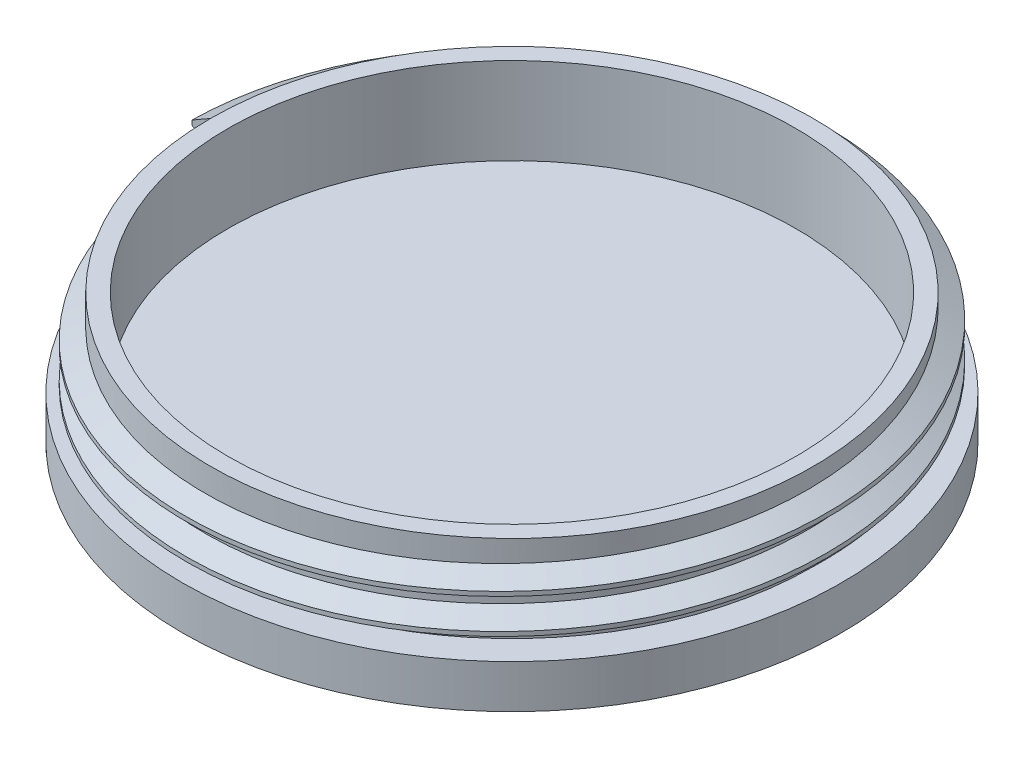
from build123d import *
from build123d.topology import SkipClean

# Parameters (mm, degrees)
SKETCH1_R           = 38
BOSS_EXTRUDE1_DEPTH = 5
SKETCH1_4_R         = 34.75
BOSS_EXTRUDE2_DEPTH = 10
THREAD1_PITCH       = 4
SKETCH6_R           = 32.750011187
CUT_EXTRUDE1_DEPTH  = 10


with BuildPart() as part:
    # Sketch1 → Boss-Extrude1 (new body)
    with BuildSketch(Plane(origin=(0, 0, 0), x_dir=(1, 0, 0), z_dir=(0, 1, 0))):
        with Locations(Location((0, 0, 0), (0, 0, 270))):
            Circle(SKETCH1_R)
    extrude(amount=-BOSS_EXTRUDE1_DEPTH)

    # Sketch1<4> → Boss-Extrude2 (add)
    with BuildSketch(Plane(origin=(0, 0, 0), x_dir=(1, 0, 0), z_dir=(0, 1, 0))):
        with Locations(Location((0, 0, 0), (0, 0, 270))):
            Circle(SKETCH1_4_R)
    extrude(amount=BOSS_EXTRUDE2_DEPTH)

    # Thread1: the profile of Thread Profile1 profile screwed along a right-hand helix of 2.5 turns, 12 arcs to a turn; built about Z, then put on its axis
    thread1_z = Axis((0, 0, 0), (0, 0, 1))
    thread1_corners = [(34.7497, 0, -0.000173205), (36.9150635, 0, 1.249999995), (36.9150635, 0, 1.749999995), (34.7497, 0, 3.000173194)]
    with BuildLine(mode=Mode.PRIVATE) as thread1_profile:
        Line(thread1_corners[0], thread1_corners[1])
        Line(thread1_corners[1], thread1_corners[2])
        Line(thread1_corners[2], thread1_corners[3])
        Line(thread1_corners[3], thread1_corners[0])
    thread1_cap = Face(thread1_profile.wire())
    thread1_turn_angles = [0, 15, 30, 45, 60, 75, 90, 105, 120, 135, 150, 165, 180, 195, 210, 225, 240, 255, 270, 285, 300, 315, 330, 345, 360]
    thread1_turn_weights = [1, 0.9659258262890683, 1, 0.9659258262890683, 1, 0.9659258262890683, 1, 0.9659258262890683, 1, 0.9659258262890683, 1, 0.9659258262890683, 1, 0.9659258262890683, 1, 0.9659258262890683, 1, 0.9659258262890683, 1, 0.9659258262890683, 1, 0.9659258262890683, 1, 0.9659258262890683, 1]
    thread1_turn_rails = [Edge.make_bspline([Vector(p[0], p[1], 0).rotate(thread1_z, thread1_turn_angles[k]) / thread1_turn_weights[k] + Vector(0, 0, p[2] + THREAD1_PITCH * thread1_turn_angles[k] / 360) for k in range(25)], [0, 0, 0, 1, 1, 2, 2, 3, 3, 4, 4, 5, 5, 6, 6, 7, 7, 8, 8, 9, 9, 10, 10, 11, 11, 12, 12, 12], 2, thread1_turn_weights) for p in thread1_corners]
    thread1_turn_sides = [Face.make_surface_from_curves(thread1_turn_rails[p[0]], thread1_turn_rails[p[1]]) for p in [(0, 1), (1, 2), (2, 3), (3, 0)]]
    thread1_last_angles = [720, 735, 750, 765, 780, 795, 810, 825, 840, 855, 870, 885, 900]
    thread1_last_weights = [1, 0.9659258262890683, 1, 0.9659258262890683, 1, 0.9659258262890683, 1, 0.9659258262890683, 1, 0.9659258262890683, 1, 0.9659258262890683, 1]
    thread1_last_rails = [Edge.make_bspline([Vector(p[0], p[1], 0).rotate(thread1_z, thread1_last_angles[k]) / thread1_last_weights[k] + Vector(0, 0, p[2] + THREAD1_PITCH * thread1_last_angles[k] / 360) for k in range(13)], [0, 0, 0, 1, 1, 2, 2, 3, 3, 4, 4, 5, 5, 6, 6, 6], 2, thread1_last_weights) for p in thread1_corners]
    thread1_last_sides = [Face.make_surface_from_curves(thread1_last_rails[p[0]], thread1_last_rails[p[1]]) for p in [(0, 1), (1, 2), (2, 3), (3, 0)]]
    thread1 = Plane(origin=(0, 10, 0), x_dir=(-1, 0, 0), z_dir=(0, -1, 0)) * Solid(Shell([*[p.moved(Location((0, 0, THREAD1_PITCH * i))) for i in range(2) for p in thread1_turn_sides], *thread1_last_sides, thread1_cap, thread1_cap.rotate(thread1_z, 900).moved(Location((0, 0, THREAD1_PITCH * 900 / 360)))]))
    add(thread1)

    # Sketch6 → Cut-Extrude1 (cut)
    with SkipClean():  # the faces are left unmerged after this step: merging them gives an invalid solid
        with BuildSketch(Plane(origin=(0, 10, 0), x_dir=(1, 0, 0), z_dir=(0, 1, 0))):
            with Locations(Location((0, 0, 0), (0, 0, 270))):
                Circle(SKETCH6_R)
        extrude(amount=-CUT_EXTRUDE1_DEPTH, mode=Mode.SUBTRACT)


solid = part.part
